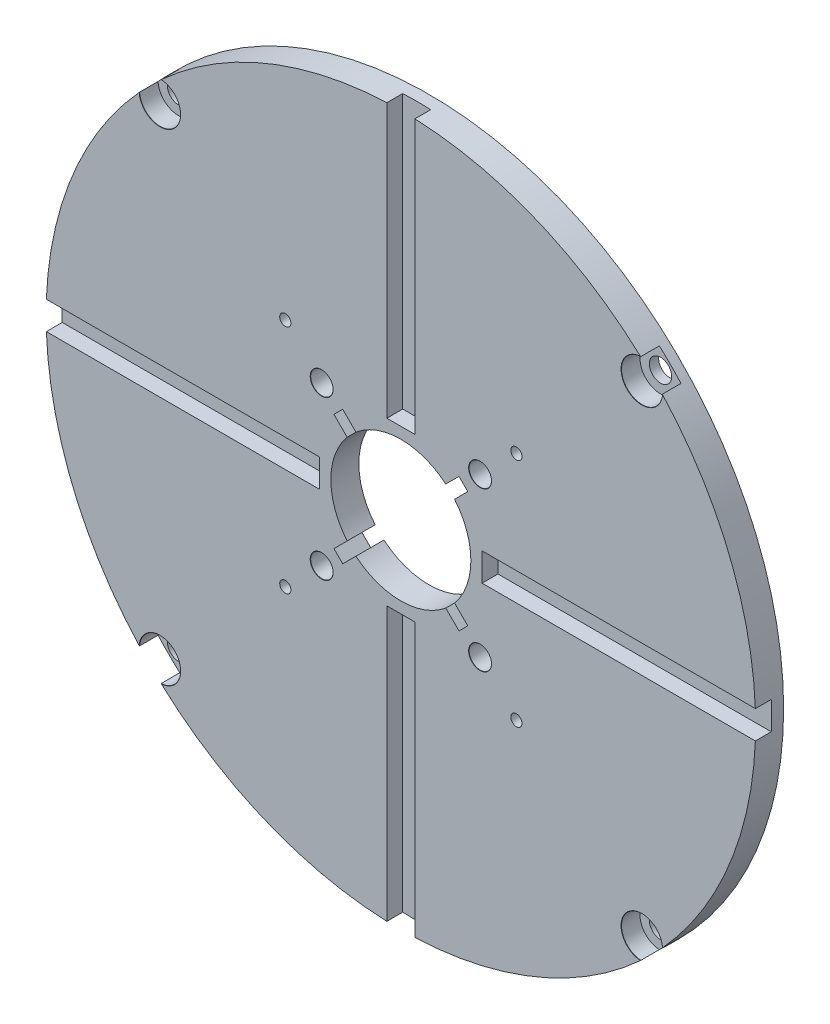
from build123d import *

# Parameters (mm, degrees)
SKETCH1_R             = 0.6
BOSS_EXTRUDE1_DEPTH   = 3
BOSS_EXTRUDE1_2_DEPTH = 3
BOSS_EXTRUDE1_3_DEPTH = 3
BOSS_EXTRUDE1_4_DEPTH = 3
BOSS_EXTRUDE2_DEPTH   = 1.3
BOSS_EXTRUDE3_DEPTH   = 3
CIRPATTERN1_COUNT     = 4


# Read off the part's stored shape, not the designer's step: M2 Clearance Hole1
with BuildPart() as part:
    # Sketch1 → Boss-Extrude1 (new body)
    with BuildSketch(Plane(origin=(0, 0, 0), x_dir=(0, 1, 0), z_dir=(0, 0, 1))):
        with BuildLine():
            Line((-1.5, 7.348469228), (-1.5, 37.970383195))
            ThreePointArc((-1.5, 37.970383195), (-26.870057685, 26.870057685), (-37.970383195, 1.5))
            Line((-37.970383195, 1.5), (-7.348469228, 1.5))
            ThreePointArc((-7.348469228, 1.5), (-6.756656365, 3.255394717), (-5.752639047, 4.812187028))
            Line((-5.752639047, 4.812187028), (-7.166852609, 6.226400591))
            Line((-7.166852609, 6.226400591), (-6.226400591, 7.166852609))
            Line((-6.226400591, 7.166852609), (-4.812187028, 5.752639047))
            ThreePointArc((-4.812187028, 5.752639047), (-3.255394717, 6.756656365), (-1.5, 7.348469228))
        make_face()
        with Locations(Location((-12.375, 12.375, 0), (0, 0, 270))):
            Circle(SKETCH1_R, mode=Mode.SUBTRACT)
    extrude(amount=BOSS_EXTRUDE1_DEPTH)

    # Sketch1<9> → Boss-Extrude2 (add)
    with BuildSketch(Plane(origin=(0, 0, 0), x_dir=(0, 1, 0), z_dir=(0, 0, 1))):
        with BuildLine():
            Line((1.5, 7.348469228), (1.5, 37.970383195))
            ThreePointArc((1.5, 37.970383195), (0, 38), (-1.5, 37.970383195))
            Line((-1.5, 37.970383195), (-1.5, 7.348469228))
            ThreePointArc((-1.5, 7.348469228), (0, 7.5), (1.5, 7.348469228))
        make_face()
        with BuildLine():
            ThreePointArc((-37.970383195, 1.5), (-38, 0), (-37.970383195, -1.5))
            Line((-37.970383195, -1.5), (-7.348469228, -1.5))
            ThreePointArc((-7.348469228, -1.5), (-7.5, 0), (-7.348469228, 1.5))
            Line((-7.348469228, 1.5), (-37.970383195, 1.5))
        make_face()
        with BuildLine():
            ThreePointArc((37.970383195, -1.5), (38, 0), (37.970383195, 1.5))
            Line((37.970383195, 1.5), (7.348469228, 1.5))
            ThreePointArc((7.348469228, 1.5), (7.5, 0), (7.348469228, -1.5))
            Line((7.348469228, -1.5), (37.970383195, -1.5))
        make_face()
        with BuildLine():
            ThreePointArc((-1.5, -37.970383195), (0, -38), (1.5, -37.970383195))
            Line((1.5, -37.970383195), (1.5, -7.348469228))
            ThreePointArc((1.5, -7.348469228), (0, -7.5), (-1.5, -7.348469228))
            Line((-1.5, -7.348469228), (-1.5, -37.970383195))
        make_face()
    extrude(amount=BOSS_EXTRUDE2_DEPTH)


with BuildPart() as body_2:
    # Sketch1 → Boss-Extrude1 2 (new body)
    with BuildSketch(Plane(origin=(0, 0, 0), x_dir=(0, 1, 0), z_dir=(0, 0, 1))):
        with BuildLine():
            Line((1.5, 37.970383195), (1.5, 7.348469228))
            ThreePointArc((1.5, 7.348469228), (3.255394717, 6.756656365), (4.812187028, 5.752639047))
            Line((4.812187028, 5.752639047), (6.226400591, 7.166852609))
            Line((6.226400591, 7.166852609), (7.166852609, 6.226400591))
            Line((7.166852609, 6.226400591), (5.752639047, 4.812187028))
            ThreePointArc((5.752639047, 4.812187028), (6.756656365, 3.255394717), (7.348469228, 1.5))
            Line((7.348469228, 1.5), (37.970383195, 1.5))
            ThreePointArc((37.970383195, 1.5), (26.870057685, 26.870057685), (1.5, 37.970383195))
        make_face()
        with Locations(Location((12.375, 12.375, 0), (0, 0, 270))):
            Circle(SKETCH1_R, mode=Mode.SUBTRACT)
    extrude(amount=BOSS_EXTRUDE1_2_DEPTH)

    # M2 Clearance Hole1 4 outline → M2 Clearance Hole1 4 (revolve, cut)
    with BuildSketch(Plane(origin=(-8.485, 8.485, 0), x_dir=(1, 0, 0), z_dir=(0, -1, 0))):
        Polygon((0, 0), (1.2, 0), (1.2, 2.975), (1.225, 3), (0, 3), align=None)
    revolve(axis=Axis((-8.485, 8.485, 0), (0, 0, 1)), mode=Mode.SUBTRACT)



with BuildPart() as body_3:
    # Sketch1 → Boss-Extrude1 3 (new body)
    with BuildSketch(Plane(origin=(0, 0, 0), x_dir=(0, 1, 0), z_dir=(0, 0, 1))):
        with BuildLine():
            Line((-7.348469228, -1.5), (-37.970383195, -1.5))
            ThreePointArc((-37.970383195, -1.5), (-26.870057685, -26.870057685), (-1.5, -37.970383195))
            Line((-1.5, -37.970383195), (-1.5, -7.348469228))
            ThreePointArc((-1.5, -7.348469228), (-3.255394717, -6.756656365), (-4.812187028, -5.752639047))
            Line((-4.812187028, -5.752639047), (-6.226400591, -7.166852609))
            Line((-6.226400591, -7.166852609), (-7.166852609, -6.226400591))
            Line((-7.166852609, -6.226400591), (-5.752639047, -4.812187028))
            ThreePointArc((-5.752639047, -4.812187028), (-6.756656365, -3.255394717), (-7.348469228, -1.5))
        make_face()
        with Locations(Location((-12.375, -12.375, 0), (0, 0, 270))):
            Circle(SKETCH1_R, mode=Mode.SUBTRACT)
    extrude(amount=BOSS_EXTRUDE1_3_DEPTH)

    # M2 Clearance Hole1 2 outline → M2 Clearance Hole1 2 (revolve, cut)
    with BuildSketch(Plane(origin=(8.485, -8.485, 0), x_dir=(1, 0, 0), z_dir=(0, -1, 0))):
        Polygon((0, 0), (1.2, 0), (1.2, 2.975), (1.225, 3), (0, 3), align=None)
    revolve(axis=Axis((8.485, -8.485, 0), (0, 0, 1)), mode=Mode.SUBTRACT)


with BuildPart() as body_4:
    # Sketch1 → Boss-Extrude1 4 (new body)
    with BuildSketch(Plane(origin=(0, 0, 0), x_dir=(0, 1, 0), z_dir=(0, 0, 1))):
        with BuildLine():
            Line((37.970383195, -1.5), (7.348469228, -1.5))
            ThreePointArc((7.348469228, -1.5), (6.756656365, -3.255394717), (5.752639047, -4.812187028))
            Line((5.752639047, -4.812187028), (7.166852609, -6.226400591))
            Line((7.166852609, -6.226400591), (6.226400591, -7.166852609))
            Line((6.226400591, -7.166852609), (4.812187028, -5.752639047))
            ThreePointArc((4.812187028, -5.752639047), (3.255394717, -6.756656365), (1.5, -7.348469228))
            Line((1.5, -7.348469228), (1.5, -37.970383195))
            ThreePointArc((1.5, -37.970383195), (26.870057685, -26.870057685), (37.970383195, -1.5))
        make_face()
        with Locations(Location((12.375, -12.375, 0), (0, 0, 270))):
            Circle(SKETCH1_R, mode=Mode.SUBTRACT)
    extrude(amount=BOSS_EXTRUDE1_4_DEPTH)

    # M2 Clearance Hole1 outline → M2 Clearance Hole1 (revolve, cut)
    with BuildSketch(Plane(origin=(8.485, 8.485, 0), x_dir=(1, 0, 0), z_dir=(0, -1, 0))):
        Polygon((0, 0), (1.2, 0), (1.2, 2.975), (1.225, 3), (0, 3), align=None)
    revolve(axis=Axis((8.485, 8.485, 0), (0, 0, 1)), mode=Mode.SUBTRACT)


with BuildPart() as boss_extrude2_piece_1:
    # of the separate pieces the step leaves, piece 1, a body of its own (boss_extrude2_pieces)
    add(part.part.solids().sort_by_distance((-37.970383195, -1.5, 1.3))[0])

    # M2 Clearance Hole1 3 outline → M2 Clearance Hole1 3 (revolve, cut)
    with BuildSketch(Plane(origin=(-8.485, -8.485, 0), x_dir=(1, 0, 0), z_dir=(0, -1, 0))):
        Polygon((0, 0), (1.2, 0), (1.2, 2.975), (1.225, 3), (0, 3), align=None)
    revolve(axis=Axis((-8.485, -8.485, 0), (0, 0, 1)), mode=Mode.SUBTRACT)


with BuildPart() as boss_extrude2_piece_2:
    # of the separate pieces the step leaves, piece 2, a body of its own (boss_extrude2_pieces)
    add(part.part.solids().sort_by_distance((-1.5, 7.348469228, 0))[0])


with BuildPart() as boss_extrude2_piece_3:
    # of the separate pieces the step leaves, piece 3, a body of its own (boss_extrude2_pieces)
    add(part.part.solids().sort_by_distance((37.970383195, -1.5, 0))[0])


with BuildPart() as body_2_1:
    add(body_2.part)

    add(body_3.part)  # Boss-Extrude3 merges body 3

    add(body_4.part)  # Boss-Extrude3 merges body 4

    add(boss_extrude2_piece_1.part)  # Boss-Extrude3 merges Boss-Extrude2 piece 1

    add(boss_extrude2_piece_2.part)  # Boss-Extrude3 merges Boss-Extrude2 piece 2

    add(boss_extrude2_piece_3.part)  # Boss-Extrude3 merges Boss-Extrude2 piece 3
    # Sketch1<10> → Boss-Extrude3 (add)
    with BuildSketch(Plane(origin=(0, 0, 0), x_dir=(0, 1, 0), z_dir=(0, 0, 1))):
        with BuildLine():
            Line((-1.5, -7.348469228), (-1.5, -8.7))
            Line((-1.5, -8.7), (1.5, -8.7))
            Line((1.5, -8.7), (1.5, -7.348469228))
            ThreePointArc((1.5, -7.348469228), (0, -7.5), (-1.5, -7.348469228))
        make_face()
        with BuildLine():
            Line((-7.348469228, 1.5), (-8.7, 1.5))
            Line((-8.7, 1.5), (-8.7, -1.5))
            Line((-8.7, -1.5), (-7.348469228, -1.5))
            ThreePointArc((-7.348469228, -1.5), (-7.5, 0), (-7.348469228, 1.5))
        make_face()
        with BuildLine():
            Line((1.5, 8.7), (-1.5, 8.7))
            Line((-1.5, 8.7), (-1.5, 7.348469228))
            ThreePointArc((-1.5, 7.348469228), (0, 7.5), (1.5, 7.348469228))
            Line((1.5, 7.348469228), (1.5, 8.7))
        make_face()
        with BuildLine():
            Line((8.7, -1.5), (8.7, 1.5))
            Line((8.7, 1.5), (7.348469228, 1.5))
            ThreePointArc((7.348469228, 1.5), (7.5, 0), (7.348469228, -1.5))
            Line((7.348469228, -1.5), (8.7, -1.5))
        make_face()
    extrude(amount=BOSS_EXTRUDE3_DEPTH)

    # Sketch8 → CBORE for M2 SHCS1 (revolve, cut)
    with BuildSketch(Plane(origin=(25.809397513, 25.809397513, 3), x_dir=(0, -1, 0), z_dir=(1, 0, 0))):
        Polygon((0, 0), (0, 3), (1.2, 3), (1.2, 2), (2.2, 2), (2.2, 0.025), (2.225, 0), align=None)
    cbore_for_m2_shcs1 = revolve(axis=Axis((25.809397513, 25.809397513, 9.35), (0, 0, -1)), mode=Mode.SUBTRACT)

    # CirPattern1: CBORE for M2 SHCS1 ×4 about axis
    cirpattern1_axis = Axis((0, 0, 0), (0, 0, 1))
    for i in range(1, CIRPATTERN1_COUNT):
        add(cbore_for_m2_shcs1.rotate(cirpattern1_axis, i * 360 / CIRPATTERN1_COUNT), mode=Mode.SUBTRACT)


solid = body_2_1.part
